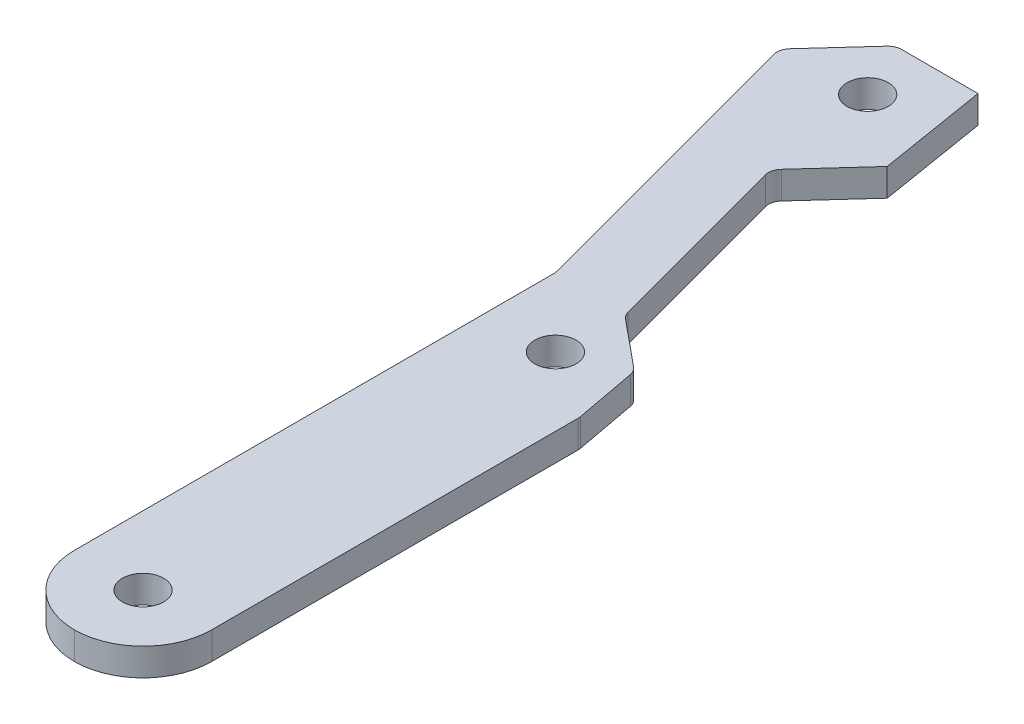
from build123d import *

# Parameters (mm, degrees)
BOSS_EXTRUDE1_DEPTH = 2
FILLET1_R           = 5
SKETCH2_R           = 1.5
CUT_EXTRUDE1_DEPTH  = 68.426998807
FILLET2_R           = 1


with BuildPart() as part:
    # Sketch1 → Boss-Extrude1 (new body)
    with BuildSketch(Plane(origin=(0, 0, 0), x_dir=(1, 0, 0), z_dir=(0, 1, 0))):
        Polygon((0, 0), (10, 0), (10, 31.741283677), (9.083107298, 36.656495551), (5.221289447, 39.832399027), (1.339003771, 54.321286421), (5.380096521, 58.756325247), (4.088254713, 66.65133283), (-1.911745287, 66.65133283), (-5.952838037, 62.216294005), (0, 40), align=None)
    extrude(amount=BOSS_EXTRUDE1_DEPTH)

    # Fillet1
    fillet1_edges = [part.edges().sort_by_distance(p)[0] for p in [
        (10, 1, 0),
        (0, 1, 0),
    ]]
    fillet(fillet1_edges, radius=FILLET1_R - 0.0001)  # a hair under: the kernel refuses the full size

    # Sketch2 → Cut-Extrude1 (cut, through all)
    with BuildSketch(Plane(origin=(0, 2, 0), x_dir=(1, 0, 0), z_dir=(0, 1, 0))):
        with Locations(Location((0.137851025, 62.574617084, 0), (0, 0, 270))):
            Circle(SKETCH2_R)
        with Locations(Location((5, 5, 0), (0, 0, 270))):
            Circle(SKETCH2_R)
        with Locations(Location((5, 35, 0), (0, 0, 270))):
            Circle(SKETCH2_R)
    extrude(amount=-CUT_EXTRUDE1_DEPTH, mode=Mode.SUBTRACT)

    # Fillet2
    fillet2_edges = [part.edges().sort_by_distance(p)[0] for p in [
        (9.083107298, 1, -36.656495551),
        (10, 1, -31.741283677),
        (0, 1, -40),
        (-5.952838037, 1, -62.216294005),
        (-1.911745287, 1, -66.65133283),
        (1.339003771, 1, -54.321286421),
        (5.221289447, 1, -39.832399027),
    ]]
    fillet(fillet2_edges, radius=FILLET2_R)


solid = part.part
